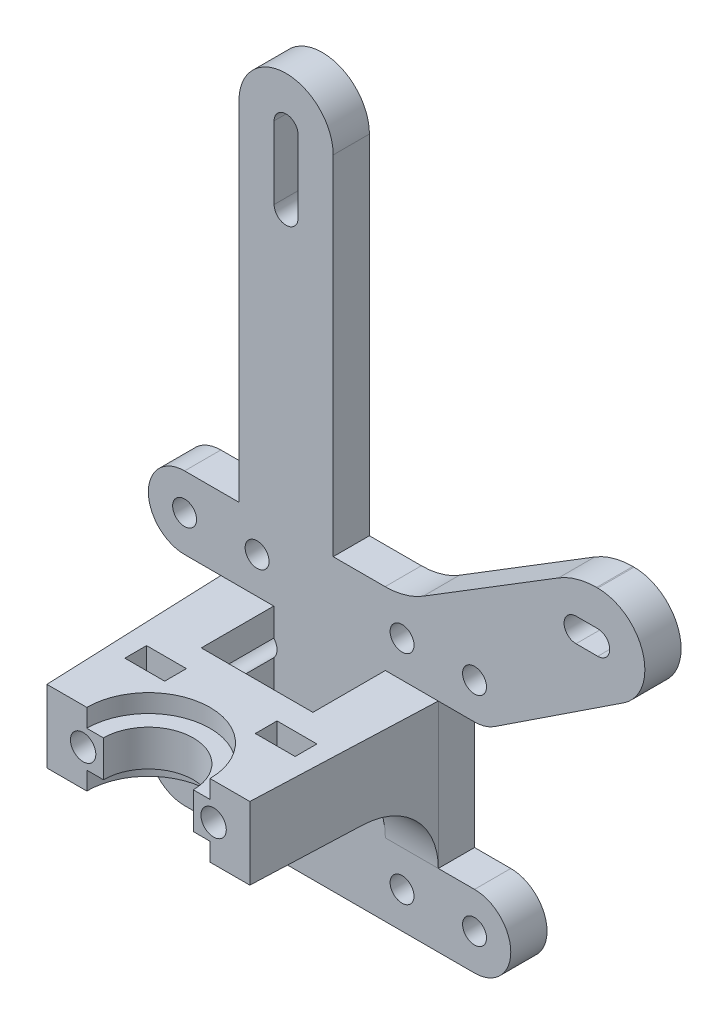
from build123d import *

# Parameters (mm, degrees)
RESSALTO_EXTRUS_O1_DEPTH = 5
ESBO_O2_W                = 5.5
ESBO_O2_H                = 3
RESSALTO_EXTRUS_O2_DEPTH = 10
ESBO_O4_W                = 8.5
ESBO_O4_H                = 2.5
ESBO_O6_R                = 1.75
CORTE_EXTRUS_O2_DEPTH    = 92.337287019
ESBO_O7_R                = 1.65
CORTE_EXTRUS_O3_DEPTH    = 10
ESBO_O8_R                = 1.65
RESSALTO_EXTRUS_O3_DEPTH = 5
FILETE3_R                = 10
FILETE4_R                = 10


with BuildPart() as part:
    # Esboço1 → Ressalto-extrusão1 (new body)
    with BuildSketch(Plane.XY):
        with BuildLine():
            Line((0.5, 68), (0.5, 33.5))
            Line((0.5, 33.5), (0.5, 20))
            Line((0.5, 20), (10.5, 20))
            Line((10.5, 20), (34, 34.5))
            Line((34, 34.5), (37, 34.5))
            ThreePointArc((37, 34.5), (43.5, 28), (37, 21.5))
            Line((37, 21.5), (15, 21.5))
            Line((15, 21.5), (15, -20))
            Line((15, -20), (-15, -20))
            Line((-15, -20), (-15, 20))
            Line((-15, 20), (-12.5, 20))
            Line((-12.5, 20), (-12.5, 68))
            ThreePointArc((-12.5, 68), (-6, 74.5), (0.5, 68))
        make_face()
        with BuildLine():
            Line((-4.35, 68), (-4.35, 58))
            ThreePointArc((-4.35, 58), (-6, 56.35), (-7.65, 58))
            Line((-7.65, 58), (-7.65, 68))
            ThreePointArc((-7.65, 68), (-6, 69.65), (-4.35, 68))
        make_face(mode=Mode.SUBTRACT)
        with BuildLine():
            Line((34, 26.35), (37, 26.35))
            ThreePointArc((37, 26.35), (38.65, 28), (37, 29.65))
            Line((37, 29.65), (34, 29.65))
            ThreePointArc((34, 29.65), (32.35, 28), (34, 26.35))
        make_face(mode=Mode.SUBTRACT)
    extrude(amount=RESSALTO_EXTRUS_O1_DEPTH)

    # Esboço2 → Ressalto-extrusão2 (add)
    with BuildSketch(Plane(origin=(0, 0, 0), x_dir=(1, 0, 0), z_dir=(0, 1, 0))):
        with BuildLine():
            Line((14, -30), (15, -5))
            Line((15, -5), (7.7, -5))
            Line((7.7, -5), (7.7, -15))
            Line((7.7, -15), (-7.7, -15))
            Line((-7.7, -15), (-7.7, -5))
            Line((-7.7, -5), (-15, -5))
            Line((-15, -5), (-14, -30))
            Line((-14, -30), (-6.2, -30))
            ThreePointArc((-6.2, -30), (0, -23.8), (6.2, -30))
            Line((6.2, -30), (14, -30))
        make_face()
        with Locations((-9, -20)):
            Rectangle(ESBO_O2_W, ESBO_O2_H, mode=Mode.SUBTRACT)
        with Locations((9, -20)):
            Rectangle(ESBO_O2_W, ESBO_O2_H, mode=Mode.SUBTRACT)
    extrude(amount=RESSALTO_EXTRUS_O2_DEPTH)

    # Esboço4 → Corte-Revolução3 (revolve, cut)
    with BuildSketch(Plane(origin=(0, 0, 0), x_dir=(0, 0, -1), z_dir=(1, 0, 0))):
        with Locations((-25.75, 8.75)):
            Rectangle(ESBO_O4_W, ESBO_O4_H)
        with Locations((-25.75, 1.25)):
            Rectangle(ESBO_O4_W, ESBO_O4_H)
    revolve(axis=Axis((0, 10, 30), (0, -1, 0)), mode=Mode.SUBTRACT)

    # Esboço6 → Corte-extrusão2 (cut, through all)
    with BuildSketch(Plane.XY.offset(30)):
        with Locations((-9, 5)):
            Circle(ESBO_O6_R)
        with Locations((9, 5)):
            Circle(ESBO_O6_R)
    extrude(amount=-CORTE_EXTRUS_O2_DEPTH, mode=Mode.SUBTRACT)

    # Esboço7 → Corte-extrusão3 (cut)
    with BuildSketch(Plane.XY.offset(5)):
        with Locations((-10, 15)):
            Circle(ESBO_O7_R)
        with Locations((-10, -15)):
            Circle(ESBO_O7_R)
        with Locations((10, -15)):
            Circle(ESBO_O7_R)
        with Locations((10, 15)):
            Circle(ESBO_O7_R)
    extrude(amount=-CORTE_EXTRUS_O3_DEPTH, mode=Mode.SUBTRACT)

    # Esboço8 → Ressalto-extrusão3 (add)
    # profile 1 of 4: a face of its own
    with BuildSketch(Plane(origin=(0, 0, 0), x_dir=(-1, 0, 0), z_dir=(0, 0, -1))):
        with BuildLine():
            Line((20, 20), (15, 20))
            Line((15, 20), (15, 10))
            Line((15, 10), (20, 10))
            ThreePointArc((20, 10), (25, 15), (20, 20))
        make_face()
        with Locations((20, 15)):
            Circle(ESBO_O8_R, mode=Mode.SUBTRACT)
    # profile 2 of 4: a face of its own
    with BuildSketch(Plane(origin=(0, 0, 0), x_dir=(-1, 0, 0), z_dir=(0, 0, -1))):
        with BuildLine():
            Line((-15, 10), (-20, 10))
            ThreePointArc((-20, 10), (-21.436224898, 10.210714245), (-22.751396578, 10.825096783))
            Line((-22.751396578, 10.825096783), (-40.576815551, 22.572625818))
            ThreePointArc((-40.576815551, 22.572625818), (-38.867092367, 21.773928519), (-37, 21.5))
            Line((-37, 21.5), (-15, 21.5))
            Line((-15, 21.5), (-15, 10))
        make_face()
        with Locations(Location((-20, 15, 0), (0, 0, 180))):
            Circle(ESBO_O8_R, mode=Mode.SUBTRACT)
    # profile 3 of 4: a face of its own
    with BuildSketch(Plane(origin=(0, 0, 0), x_dir=(-1, 0, 0), z_dir=(0, 0, -1))):
        with BuildLine():
            Line((15, -10), (20, -10))
            ThreePointArc((20, -10), (25, -15), (20, -20))
            Line((20, -20), (15, -20))
            Line((15, -20), (15, -10))
        make_face()
        with Locations(Location((20, -15, 0), (0, 0, 180))):
            Circle(ESBO_O8_R, mode=Mode.SUBTRACT)
    # profile 4 of 4: a face of its own
    with BuildSketch(Plane(origin=(0, 0, 0), x_dir=(-1, 0, 0), z_dir=(0, 0, -1))):
        with BuildLine():
            Line((-20, -20), (-15, -20))
            Line((-15, -20), (-15, -10))
            Line((-15, -10), (-20, -10))
            ThreePointArc((-20, -10), (-25, -15), (-20, -20))
        make_face()
        with Locations((-20, -15)):
            Circle(ESBO_O8_R, mode=Mode.SUBTRACT)
    extrude(amount=-RESSALTO_EXTRUS_O3_DEPTH)

    # Filete3
    filete3_edges = [part.edges().sort_by_distance(p)[0] for p in [
        (10.5, 20, 2.5),
        (34, 34.5, 2.5),
    ]]
    fillet(filete3_edges, radius=FILETE3_R)

    # Filete4
    filete4_edges = [part.edges().sort_by_distance(p)[0] for p in [
        (-11.35, 0, 5),
        (11.35, 0, 5),
    ]]
    fillet(filete4_edges, radius=FILETE4_R - 0.0001)  # a hair under: the kernel refuses the full size


solid = part.part
